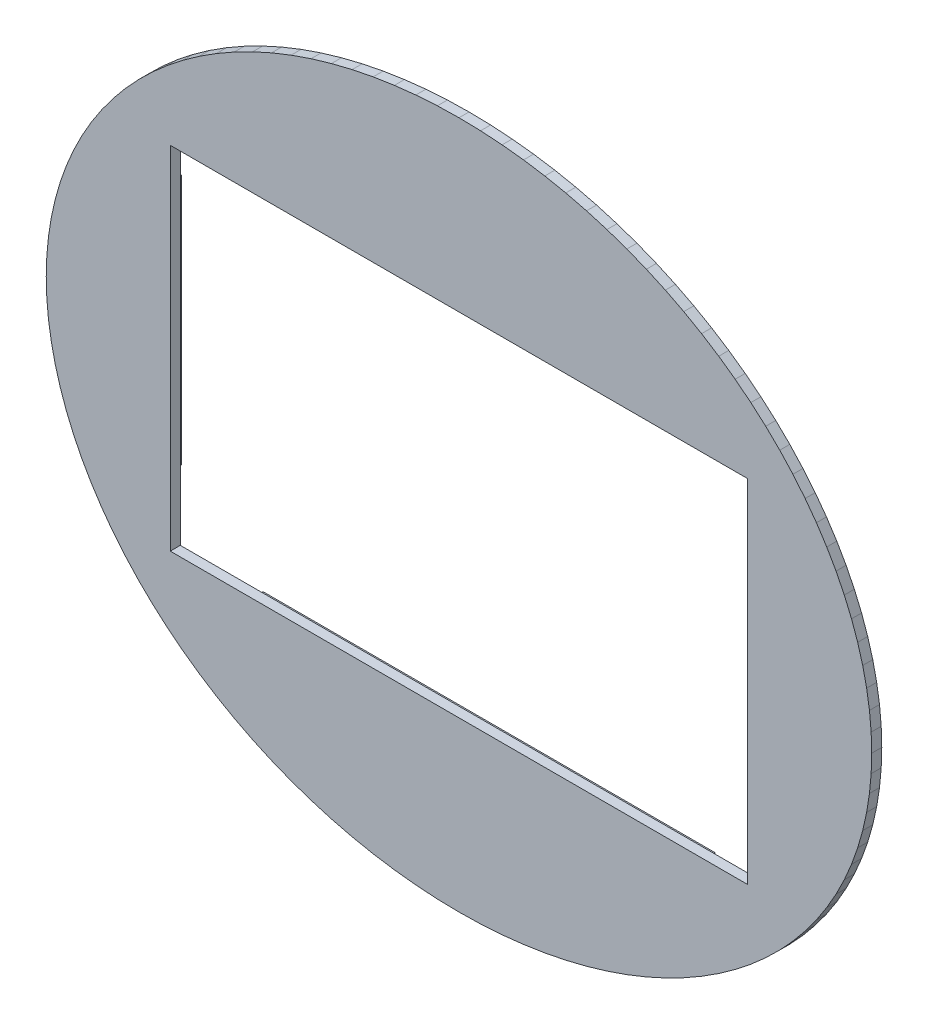
from build123d import *

# Parameters (mm, degrees)
BOSS_EXTRUDE1_DEPTH             = 2000
SKETCH2_W                       = 115000
SKETCH2_H                       = 70000
CUT_EXTRUDE1_DEPTH              = 107020.108098933
SKETCH3_W                       = 2250
SKETCH3_H                       = 50000
BOSS_EXTRUDE2_DEPTH             = 4000
SKETCH4_W                       = 90000
SKETCH4_H                       = 2250
BOSS_EXTRUDE3_DEPTH             = 4000
SKETCH5_W                       = 90000
SKETCH5_H                       = 2250
BOSS_EXTRUDE4_DEPTH             = 4000
SKETCH6_W                       = 2250
SKETCH6_H                       = 50000
BOSS_EXTRUDE5_DEPTH             = 4000
SCALE4_SCALE                    = 0.001
SKETCH17_W                      = 4
SKETCH17_H                      = 50
BOSS_EXTRUDE7_DEPTH             = 4
F_40_0_098_DIAMETER_HOLE1_D     = 2.50000008
F_40_0_098_DIAMETER_HOLE1_DEPTH = 3
F_40_0_098_DIAMETER_HOLE1_TIP   = 0.751075798
SKETCH21_W                      = 90
SKETCH21_H                      = 4
BOSS_EXTRUDE8_DEPTH             = 4
SKETCH22_W                      = 4
SKETCH22_H                      = 50
BOSS_EXTRUDE9_DEPTH             = 4
SKETCH23_W                      = 90
SKETCH23_H                      = 4
BOSS_EXTRUDE10_DEPTH            = 4


with BuildPart() as part:
    # Sketch1 → Boss-Extrude1 (new body)
    with BuildSketch(Plane(origin=(0, 0, 66500), x_dir=(-1, 0, 0), z_dir=(0, 0, -1))):
        Polygon((41099.998474121, 59322.700500488), (37318.000793457, 61033.9012146), (33433.799743652, 62577.899932861), (29457.799911499, 63950.298309326), (25401.19934082, 65147.399902344), (21274.900436401, 66165.901184082), (17090.299606323, 67003.09753418), (12858.90007019, 67656.600952148), (8592.240333557, 68124.702453613), (4302.020072937, 68406.097412109), (0, 68500), (-4302.020072937, 68406.097412109), (-8592.240333557, 68124.702453613), (-12858.90007019, 67656.600952148), (-17090.299606323, 67003.09753418), (-21274.900436401, 66165.901184082), (-25401.19934082, 65147.399902344), (-29457.799911499, 63950.298309326), (-33433.799743652, 62577.899932861), (-37318.000793457, 61033.9012146), (-41099.998474121, 59322.700500488), (-44769.298553467, 57448.89831543), (-48315.898895264, 55417.701721191), (-51730.098724365, 53234.50088501), (-55002.498626709, 50905.39932251), (-58124.198913574, 48436.798095703), (-61086.498260498, 45835.399627686), (-63881.401062012, 43108.3984375), (-66501.197814941, 40263.301849365), (-68938.697814941, 37307.800292969), (-71187.301635742, 34250), (-73240.699768066, 31098.300933838), (-75093.399047852, 27861.499786377), (-76740.303039551, 24548.2006073), (-78176.803588867, 21167.699813843), (-79399.101257324, 17729.099273682), (-80403.701782227, 14241.99962616), (-81188.003540039, 10715.800285339), (-81749.702453613, 7160.200119019), (-82087.303161621, 3585.010051727), (-82199.996948242, 0), (-82087.303161621, -3585.010051727), (-81749.702453613, -7160.200119019), (-81188.003540039, -10715.800285339), (-80403.701782227, -14241.99962616), (-79399.101257324, -17729.099273682), (-78176.803588867, -21167.699813843), (-76740.303039551, -24548.2006073), (-75093.399047852, -27861.499786377), (-73240.699768066, -31098.300933838), (-71187.301635742, -34250), (-68938.697814941, -37307.800292969), (-66501.197814941, -40263.301849365), (-63881.401062012, -43108.3984375), (-61086.498260498, -45835.399627686), (-58124.198913574, -48436.798095703), (-55002.498626709, -50905.39932251), (-51730.098724365, -53234.50088501), (-48315.898895264, -55417.701721191), (-44769.298553467, -57448.89831543), (-41099.998474121, -59322.700500488), (-37318.000793457, -61033.9012146), (-33433.799743652, -62577.899932861), (-29457.799911499, -63950.298309326), (-25401.19934082, -65147.399902344), (-21274.900436401, -66165.901184082), (-17090.299606323, -67003.09753418), (-12858.90007019, -67656.600952148), (-8592.240333557, -68124.702453613), (-4302.020072937, -68406.097412109), (0, -68500), (4302.020072937, -68406.097412109), (8592.240333557, -68124.702453613), (12858.90007019, -67656.600952148), (17090.299606323, -67003.09753418), (21274.900436401, -66165.901184082), (25401.19934082, -65147.399902344), (29457.799911499, -63950.298309326), (33433.799743652, -62577.899932861), (37318.000793457, -61033.9012146), (41099.998474121, -59322.700500488), (44769.298553467, -57448.89831543), (48315.898895264, -55417.701721191), (51730.098724365, -53234.50088501), (55002.498626709, -50905.39932251), (58124.198913574, -48436.798095703), (61086.498260498, -45835.399627686), (63881.401062012, -43108.3984375), (66501.197814941, -40263.301849365), (68938.697814941, -37307.800292969), (71187.301635742, -34250), (73240.699768066, -31098.300933838), (75093.399047852, -27861.499786377), (76740.303039551, -24548.2006073), (78176.803588867, -21167.699813843), (79399.101257324, -17729.099273682), (80403.701782227, -14241.99962616), (81188.003540039, -10715.800285339), (81749.702453613, -7160.200119019), (82087.303161621, -3585.010051727), (82199.996948242, 0), (82087.303161621, 3585.010051727), (81749.702453613, 7160.200119019), (81188.003540039, 10715.800285339), (80403.701782227, 14241.99962616), (79399.101257324, 17729.099273682), (78176.803588867, 21167.699813843), (76740.303039551, 24548.2006073), (75093.399047852, 27861.499786377), (73240.699768066, 31098.300933838), (71187.301635742, 34250), (68938.697814941, 37307.800292969), (66501.197814941, 40263.301849365), (63881.401062012, 43108.3984375), (61086.498260498, 45835.399627686), (58124.198913574, 48436.798095703), (55002.498626709, 50905.39932251), (51730.098724365, 53234.50088501), (48315.898895264, 55417.701721191), (44769.298553467, 57448.89831543), align=None)
    extrude(amount=-BOSS_EXTRUDE1_DEPTH)

    # Sketch2 → Cut-Extrude1 (cut, through all)
    with BuildSketch(Plane.XY.offset(68500)):
        Rectangle(SKETCH2_W, SKETCH2_H)
    extrude(amount=-CUT_EXTRUDE1_DEPTH, mode=Mode.SUBTRACT)

    # Sketch3 → Boss-Extrude2 (add)
    with BuildSketch(Plane(origin=(0, 0, 66500), x_dir=(-1, 0, 0), z_dir=(0, 0, -1))):
        with Locations((62375, 0)):
            Rectangle(SKETCH3_W, SKETCH3_H)
    extrude(amount=BOSS_EXTRUDE2_DEPTH)

    # Sketch4 → Boss-Extrude3 (add)
    with BuildSketch(Plane(origin=(0, 0, 66500), x_dir=(-1, 0, 0), z_dir=(0, 0, -1))):
        with Locations((0, 39875)):
            Rectangle(SKETCH4_W, SKETCH4_H)
    extrude(amount=BOSS_EXTRUDE3_DEPTH)

    # Sketch5 → Boss-Extrude4 (add)
    with BuildSketch(Plane(origin=(0, 0, 66500), x_dir=(-1, 0, 0), z_dir=(0, 0, -1))):
        with Locations((0, -39875)):
            Rectangle(SKETCH5_W, SKETCH5_H)
    extrude(amount=BOSS_EXTRUDE4_DEPTH)

    # Sketch6 → Boss-Extrude5 (add)
    with BuildSketch(Plane(origin=(0, 0, 66500), x_dir=(-1, 0, 0), z_dir=(0, 0, -1))):
        with Locations((-62375, 0)):
            Rectangle(SKETCH6_W, SKETCH6_H)
    extrude(amount=BOSS_EXTRUDE5_DEPTH)


with BuildPart() as part_1:
    # Scale4: scaled about (0, 0, 67152.933263132)
    add(part.part.scale(SCALE4_SCALE).moved(Location((0, 0, 67085.780329869))))

    # Sketch17 → Boss-Extrude7 (add)
    with BuildSketch(Plane(origin=(0, 0, 67152.280329869), x_dir=(-1, 0, 0), z_dir=(0, 0, -1))):
        with Locations((-63.25, 0)):
            Rectangle(SKETCH17_W, SKETCH17_H)
    extrude(amount=BOSS_EXTRUDE7_DEPTH)

    # #40 (0.098) Diameter Hole1
    with Locations(Plane(origin=(0, 0, 67148.280329869), x_dir=(-1, 0, 0), z_dir=(0, 0, -1))):
        with Locations((-63.25, 0)):
            Hole(F_40_0_098_DIAMETER_HOLE1_D / 2, depth=F_40_0_098_DIAMETER_HOLE1_DEPTH)
            with Locations((0, 0, -(F_40_0_098_DIAMETER_HOLE1_DEPTH + F_40_0_098_DIAMETER_HOLE1_TIP / 2))):  # 118° drill point
                Cone(0, F_40_0_098_DIAMETER_HOLE1_D / 2, F_40_0_098_DIAMETER_HOLE1_TIP, mode=Mode.SUBTRACT)

    # Sketch21 → Boss-Extrude8 (add)
    with BuildSketch(Plane(origin=(0, 0, 67152.280329869), x_dir=(-1, 0, 0), z_dir=(0, 0, -1))):
        with Locations((0, 40.75)):
            Rectangle(SKETCH21_W, SKETCH21_H)
    extrude(amount=BOSS_EXTRUDE8_DEPTH)

    # Sketch22 → Boss-Extrude9 (add)
    with BuildSketch(Plane(origin=(0, 0, 67152.280329869), x_dir=(-1, 0, 0), z_dir=(0, 0, -1))):
        with Locations((63.25, 0)):
            Rectangle(SKETCH22_W, SKETCH22_H)
    extrude(amount=BOSS_EXTRUDE9_DEPTH)

    # Sketch23 → Boss-Extrude10 (add)
    with BuildSketch(Plane(origin=(0, 0, 67152.280329869), x_dir=(-1, 0, 0), z_dir=(0, 0, -1))):
        with Locations((0, -40.75)):
            Rectangle(SKETCH23_W, SKETCH23_H)
    extrude(amount=BOSS_EXTRUDE10_DEPTH)


solid = part_1.part
